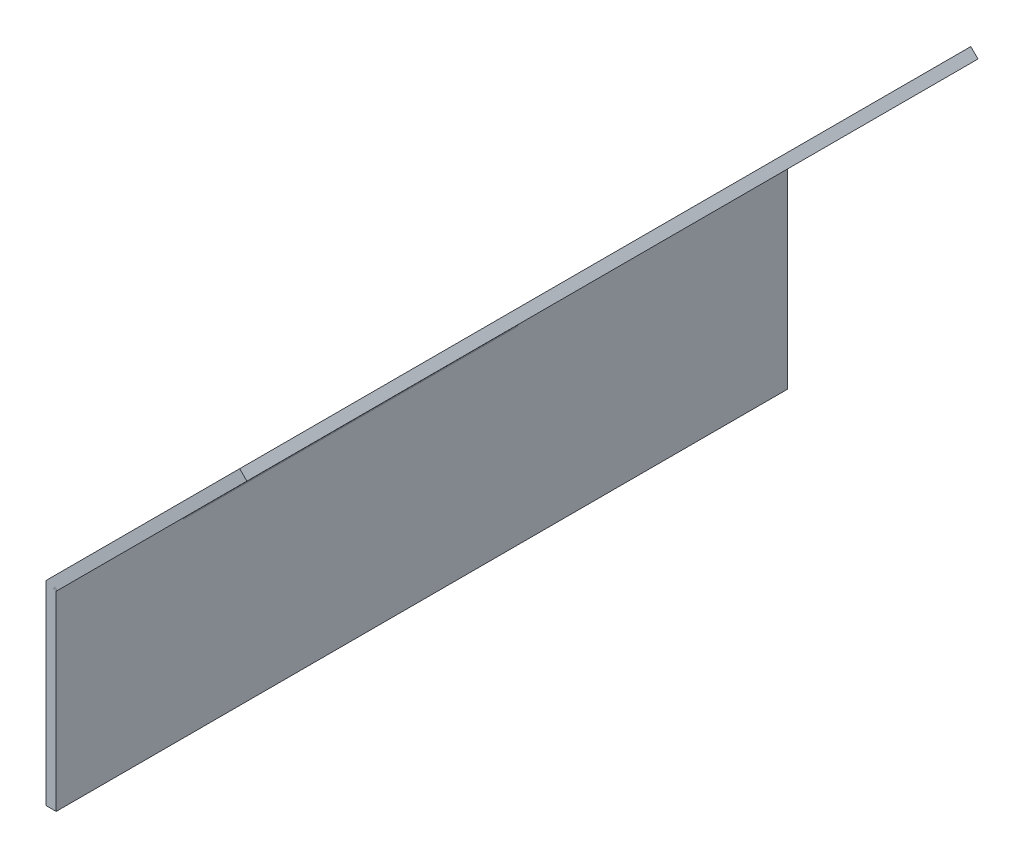
from build123d import *

# Parameters (mm, degrees)
BOSS_EXTRUDE2_DEPTH  = 292.1
CONVERT_SOLID2_START = -292.1
CONVERT_SOLID2_DEPTH = 292.1
SKETCH12_W           = 50.8
SKETCH12_H           = 76.571974388
CUT_EXTRUDE1_DEPTH   = 292.1
SKETCH13_W           = 107.95
SKETCH13_H           = 76.571974388
CUT_EXTRUDE2_DEPTH   = 292.1
SKETCH14_R           = 3.2639
CUT_EXTRUDE3_DEPTH   = 292.1
SKETCH16_W           = 38.1
SKETCH16_H           = 76.686538097
CUT_EXTRUDE4_DEPTH   = 365.222577978


# Read off the part's stored shape, not the designer's step: Convert-Solid2
with BuildPart() as part:
    # Sketch7 → Boss-Extrude2 (new body)
    with BuildSketch(Plane.XY):
        Polygon((0, 0), (4.064, 0), (4.064, 76.2), (80.264, 152.4), (77.390318041, 155.273681959), (77.208487056, 155.091850973), (0, 77.883363917), align=None)
    extrude(amount=-BOSS_EXTRUDE2_DEPTH)


with BuildPart() as body_2:
    # Convert-Solid2 outline → Convert-Solid2 (new body)
    with BuildSketch(Plane.XY.offset(CONVERT_SOLID2_START)):
        with BuildLine():
            Line((2.84988, 0), (4.064, 0))
            Line((4.064, 0), (4.064, 75.673948776))
            ThreePointArc((4.064, 75.673948776), (4.160672994, 76.159956735), (4.435974388, 76.571974388))
            Line((4.435974388, 76.571974388), (80.264, 152.4))
            Line((80.264, 152.4), (79.405487515, 153.258512485))
            Line((79.405487515, 153.258512485), (3.577461903, 77.430486873))
            ThreePointArc((3.577461903, 77.430486873), (3.038972376, 76.624580344), (2.84988, 75.673948776))
            Line((2.84988, 75.673948776), (2.84988, 0))
        make_face()
    extrude(amount=CONVERT_SOLID2_DEPTH)

    # Sketch12 → Cut-Extrude1 (cut)
    with BuildSketch(Plane(origin=(152.4, 0, 0), x_dir=(0, 0, -1), z_dir=(1, 0, 0))):
        with Locations((25.4, 38.285987194)):
            Rectangle(SKETCH12_W, SKETCH12_H)
    extrude(amount=-CUT_EXTRUDE1_DEPTH, mode=Mode.SUBTRACT)

    # Sketch13 → Cut-Extrude2 (cut)
    with BuildSketch(Plane(origin=(152.4, 0, 0), x_dir=(0, 0, -1), z_dir=(1, 0, 0))):
        with Locations((238.125, 38.285987194)):
            Rectangle(SKETCH13_W, SKETCH13_H)
    extrude(amount=-CUT_EXTRUDE2_DEPTH, mode=Mode.SUBTRACT)

    # Sketch14 → Cut-Extrude3 (cut)
    with BuildSketch(Plane.ZY.offset(-2.84988)):
        with Locations(Location((-171.45, 12.7, 0), (0, 0, 270))):
            Circle(SKETCH14_R)
        with Locations(Location((-63.5, 12.7, 0), (0, 0, 270))):
            Circle(SKETCH14_R)
    extrude(amount=-CUT_EXTRUDE3_DEPTH, mode=Mode.SUBTRACT)

    # Sketch16 → Cut-Extrude4 (cut, through all)
    with BuildSketch(Plane(origin=(152.4, 0, 0), x_dir=(0, 0, -1), z_dir=(1, 0, 0))):
        with Locations((273.05, 114.915243437)):
            Rectangle(SKETCH16_W, SKETCH16_H)
    extrude(amount=-CUT_EXTRUDE4_DEPTH, mode=Mode.SUBTRACT)


solid = Compound([part.part, body_2.part])
